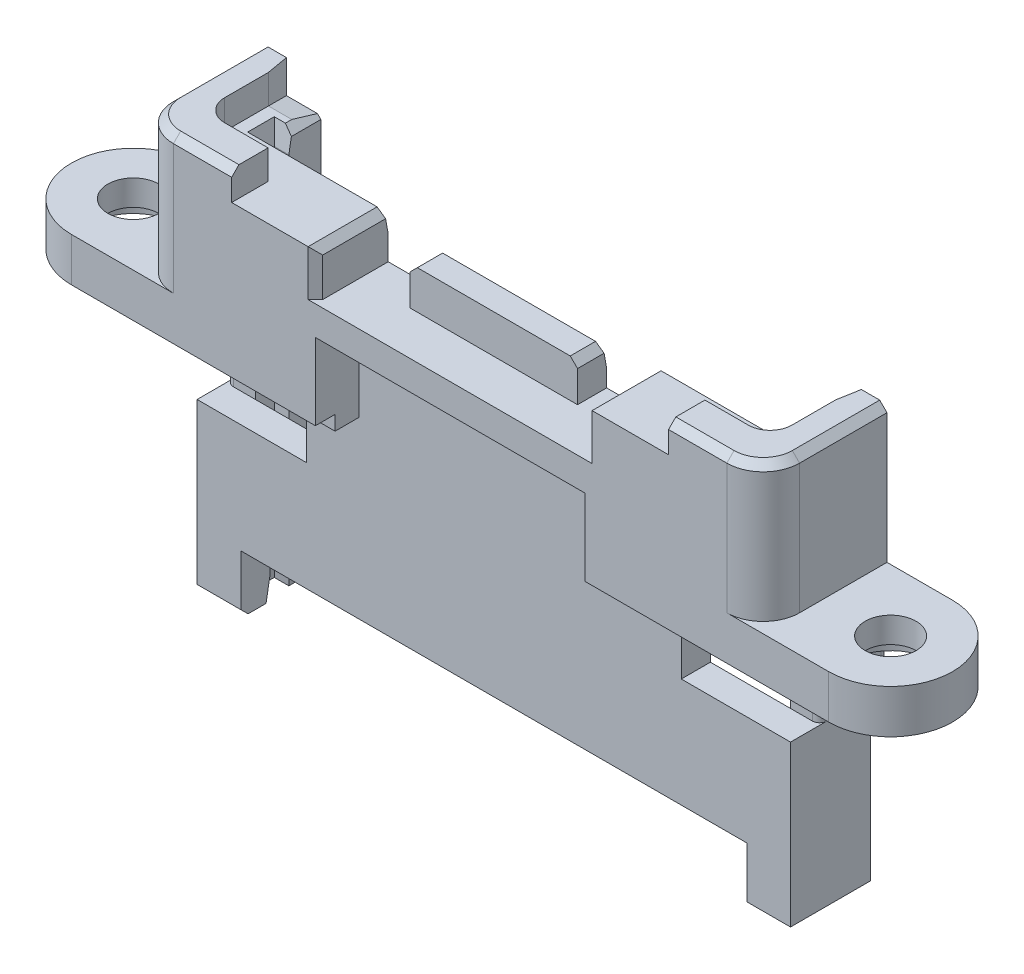
from build123d import *
from OCP.BRepFilletAPI import BRepFilletAPI_MakeChamfer

# Parameters (mm, degrees)
BOSS_EXTRUDE1_DEPTH             = 7.4
BOSS_EXTRUDE1_DEPTH_BACK        = 20
SKETCH2_R                       = 1.75
BOSS_EXTRUDE2_DEPTH             = 3
BOSS_EXTRUDE7_DEPTH             = 2
BOSS_EXTRUDE7_DIRECTION_2_REACH = 43.12
SKETCH21_R                      = 3
CUT_EXTRUDE11_DEPTH             = 1.25
CUT_EXTRUDE10_START             = -7.4
CUT_EXTRUDE10_DEPTH             = 7.4
CUT_EXTRUDE3_DEPTH              = 37.60686411
CUT_EXTRUDE3_DEPTH_BACK         = 37.60686411
SKETCH12_W                      = 3
SKETCH12_H                      = 17
CUT_EXTRUDE6_DEPTH              = 37.60686411
SKETCH19_W                      = 18.5
SKETCH19_H                      = 3.15
SKETCH19_H_2                    = 5.25
CUT_EXTRUDE9_DEPTH              = 37.678501878
SHELL1_OUTLINE_W                = 7.15
SHELL1_OUTLINE_H                = 6.4
SHELL1_DEPTH                    = 3
SKETCH13_W                      = 34.75
SKETCH13_H                      = 4
CUT_EXTRUDE4_DEPTH              = 37.60686411
SKETCH22_W                      = 7.5
SKETCH22_H                      = 2
CUT_EXTRUDE12_DEPTH             = 5.5
SKETCH23_W                      = 3
SKETCH23_H                      = 8.5
BOSS_EXTRUDE8_DEPTH             = 1.2
FILLET2_R                       = 0.5
CHAMFER3_SIZE                   = 0.5
CHAMFER4_SIZE                   = 0.5
BOSS_EXTRUDE9_DEPTH             = 1
CHAMFER5_SIZE                   = 1.5
CHAMFER5_SIZE2                  = 0.264490471


# Read off the part's stored shape, not the designer's step: Shell1
with BuildPart() as part:
    # Sketch1 → Boss-Extrude1 (new, two sides: drawn at the far end of the back side and taken through both)
    with BuildSketch(Plane(origin=(0, 0, 0), x_dir=(1, 0, 0), z_dir=(0, 1, 0)).offset(-BOSS_EXTRUDE1_DEPTH_BACK)):
        Polygon((17.375, 3.5), (20.375, 3.5), (20.375, -5), (-20.375, -5), (-20.375, 3.5), (-17.375, 3.5), (-17.375, 1.3), (-18.375, 1.3), (-18.375, 0), (18.375, 0), (18.375, 1.3), (17.375, 1.3), align=None)
    extrude(amount=BOSS_EXTRUDE1_DEPTH + BOSS_EXTRUDE1_DEPTH_BACK)

    # Sketch2 → Boss-Extrude2 (add)
    with BuildSketch(Plane(origin=(0, 0, 0), x_dir=(1, 0, 0), z_dir=(0, 1, 0))):
        with BuildLine():
            Line((20.375, -5), (26, -5))
            ThreePointArc((26, -5), (30.25, -0.75), (26, 3.5))
            Line((26, 3.5), (20.375, 3.5))
            Line((20.375, 3.5), (20.375, -5))
        make_face()
        with Locations(Location((26, -0.75, 0), (0, 0, 270))):
            Circle(SKETCH2_R, mode=Mode.SUBTRACT)
    boss_extrude2 = extrude(amount=-BOSS_EXTRUDE2_DEPTH)

    # Sketch8 → Boss-Extrude7 (add)
    with BuildSketch(Plane(origin=(0, 7.4, 0), x_dir=(1, 0, 0), z_dir=(0, 1, 0))):
        with BuildLine():
            Line((15, -5), (19, -5))
            ThreePointArc((19, -5), (20.767766953, -4.267766953), (21.5, -2.5))
            Line((21.5, -2.5), (21.5, 3.5))
            Line((21.5, 3.5), (19.475, 3.5))
            Line((19.475, 3.5), (19.475, -1))
            ThreePointArc((19.475, -1), (19.035660172, -2.060660172), (17.975, -2.5))
            Line((17.975, -2.5), (15, -2.5))
            Line((15, -2.5), (15, -5))
        make_face()
    boss_extrude7 = extrude(amount=BOSS_EXTRUDE7_DEPTH)

    # Sketch8 → Boss-Extrude7 direction 2 (add, up to next)
    with BuildSketch(Plane(origin=(0, 7.4, 0), x_dir=(1, 0, 0), z_dir=(0, 1, 0)), mode=Mode.PRIVATE) as boss_extrude7_direction_2_sk1:
        with BuildLine():
            Line((15, -5), (19, -5))
            ThreePointArc((19, -5), (20.767766953, -4.267766953), (21.5, -2.5))
            Line((21.5, -2.5), (21.5, 3.5))
            Line((21.5, 3.5), (19.475, 3.5))
            Line((19.475, 3.5), (19.475, -1))
            ThreePointArc((19.475, -1), (19.035660172, -2.060660172), (17.975, -2.5))
            Line((17.975, -2.5), (15, -2.5))
            Line((15, -2.5), (15, -5))
        make_face()
    boss_extrude7_direction_2_tool1 = extrude(boss_extrude7_direction_2_sk1.sketch, amount=-BOSS_EXTRUDE7_DIRECTION_2_REACH, mode=Mode.PRIVATE) - part.part
    boss_extrude7_direction_2 = boss_extrude7_direction_2_tool1.solids().sort_by_distance((16.4875, 7.4, 2.607005))[0]
    add(boss_extrude7_direction_2)

    # Sketch21 → Cut-Extrude11 (cut)
    with BuildSketch(Plane.XZ.offset(3)):
        with Locations(Location((26, 0.75, 0), (0, 0, 270))):
            Circle(SKETCH21_R)
    cut_extrude11 = extrude(amount=-CUT_EXTRUDE11_DEPTH, mode=Mode.SUBTRACT)

    # Sketch20 → Cut-Extrude10 (cut)
    with BuildSketch(Plane(origin=(0, 7.4, 0), x_dir=(1, 0, 0), z_dir=(0, 1, 0)).offset(CUT_EXTRUDE10_START)):
        with BuildLine():
            Line((20.375, -5), (20.375, -4.587911636))
            ThreePointArc((20.375, -4.587911636), (19.717711958, -4.894762941), (19, -5))
            Line((19, -5), (20.375, -5))
        make_face()
    cut_extrude10 = extrude(amount=CUT_EXTRUDE10_DEPTH, mode=Mode.SUBTRACT)

    # Mirror1: Boss-Extrude2, Boss-Extrude7, Boss-Extrude7 direction 2, Cut-Extrude11, Cut-Extrude10 across plane
    add(boss_extrude2.mirror(Plane(origin=(0, 0, 0), x_dir=(0, 0, 1), z_dir=(1, 0, 0))))
    add(boss_extrude7.mirror(Plane(origin=(0, 0, 0), x_dir=(0, 0, 1), z_dir=(1, 0, 0))))
    add(boss_extrude7_direction_2.mirror(Plane(origin=(0, 0, 0), x_dir=(0, 0, 1), z_dir=(1, 0, 0))))
    add(cut_extrude11.mirror(Plane(origin=(0, 0, 0), x_dir=(0, 0, 1), z_dir=(1, 0, 0))), mode=Mode.SUBTRACT)
    add(cut_extrude10.mirror(Plane(origin=(0, 0, 0), x_dir=(0, 0, 1), z_dir=(1, 0, 0))), mode=Mode.SUBTRACT)

    # Sketch12 → Cut-Extrude3 (cut, two sides: drawn at the far end of the back side and taken through both)
    with BuildSketch(Plane(origin=(0, 0, 0), x_dir=(0, 0, -1), z_dir=(1, 0, 0)).offset(-CUT_EXTRUDE3_DEPTH_BACK)):
        with Locations((-3.5, -11.5)):
            Rectangle(SKETCH12_W, SKETCH12_H)
    extrude(amount=CUT_EXTRUDE3_DEPTH + CUT_EXTRUDE3_DEPTH_BACK, mode=Mode.SUBTRACT)

    # Sketch15 → Cut-Extrude6 (cut, through all)
    with BuildSketch(Plane(origin=(0, 0, 0), x_dir=(-1, 0, 0), z_dir=(0, 0, -1))):
        Polygon((-9.25, 7.4), (-9.25, 4.25), (-5.75, 4.25), (-5.75, 6.9), (5.75, 6.9), (5.75, 4.25), (9.25, 4.25), (9.25, 7.4), align=None)
    extrude(amount=-CUT_EXTRUDE6_DEPTH, mode=Mode.SUBTRACT)

    # Sketch19 → Cut-Extrude9 (cut, through all)
    with BuildSketch(Plane.XY.offset(2)):
        with Locations((0, 5.825)):
            Rectangle(SKETCH19_W, SKETCH19_H)
        with Locations((0, -0.375)):
            Rectangle(SKETCH19_W, SKETCH19_H_2)
    extrude(amount=CUT_EXTRUDE9_DEPTH, mode=Mode.SUBTRACT)

    # Shell1 outline → Shell1 (cut)
    with BuildSketch(Plane.XY):
        with Locations((14.825, 2.2)):
            Rectangle(SHELL1_OUTLINE_W, SHELL1_OUTLINE_H)
        with Locations((-14.825, 2.2)):
            Rectangle(SHELL1_OUTLINE_W, SHELL1_OUTLINE_H)
    extrude(amount=SHELL1_DEPTH, mode=Mode.SUBTRACT)

    # Sketch13 → Cut-Extrude4 (cut, through all)
    with BuildSketch(Plane.XY):
        with Locations((0, -18)):
            Rectangle(SKETCH13_W, SKETCH13_H)
    extrude(amount=CUT_EXTRUDE4_DEPTH, mode=Mode.SUBTRACT)

    # Sketch22 → Cut-Extrude12 (cut)
    with BuildSketch(Plane.XZ.offset(3)):
        with Locations((16.625, 1)):
            Rectangle(SKETCH22_W, SKETCH22_H)
        with Locations((-16.625, 1)):
            Rectangle(SKETCH22_W, SKETCH22_H)
    extrude(amount=CUT_EXTRUDE12_DEPTH, mode=Mode.SUBTRACT)

    # Sketch23 → Boss-Extrude8 (add)
    with BuildSketch(Plane(origin=(0, 0, -3.5), x_dir=(-1, 0, 0), z_dir=(0, 0, -1))):
        with Locations((-18.875, -4.25)):
            Rectangle(SKETCH23_W, SKETCH23_H)
        with Locations((18.875, -4.25)):
            Rectangle(SKETCH23_W, SKETCH23_H)
    extrude(amount=BOSS_EXTRUDE8_DEPTH)

    # Fillet2
    fillet2_edges = [part.edges().sort_by_distance(p)[0] for p in [
        (20.375, -5.75, 0),
        (-20.375, -5.75, 0),
        (20.375, -4.25, -4.7),
        (-20.375, -4.25, -4.7),
    ]]
    fillet(fillet2_edges, radius=FILLET2_R)

    # Chamfer3
    chamfer3_edges = [part.edges().sort_by_distance(p)[0] for p in [
        (-20.767766953, 9.4, 4.267766953),
        (-21.5, 9.4, -0.5),
        (-17, 9.4, 5),
        (9.25, 7.4, 2.5),
        (-9.25, 5.825, 5),
        (-9.25, 7.4, 2.5),
        (9.25, 5.825, 5),
        (5.75, 6.9, 1),
        (-5.75, 6.9, 1),
        (17.375, 7.4, -2.4),
        (-17.375, 7.4, -2.4),
        (17, 9.4, 5),
        (20.767766953, 9.4, 4.267766953),
        (21.5, 9.4, -0.5),
    ]]
    chamfer(chamfer3_edges, length=CHAMFER3_SIZE)

    # Chamfer4
    chamfer4_edges = [part.edges().sort_by_distance(p)[0] for p in [
        (18.875, -20, -3.5),
        (20.375, -20, -0.75),
        (-18.875, -20, 2),
        (18.875, -20, 2),
        (-18.875, -20, -3.5),
        (-20.375, -20, -0.75),
    ]]
    chamfer(chamfer4_edges, length=CHAMFER4_SIZE)

    # Sketch25 → Boss-Extrude9 (add)
    with BuildSketch(Plane.XZ.offset(3)):
        with BuildLine():
            Line((-22.5, 2.65), (-12.875, 2.65))
            Line((-12.875, 2.65), (-12.875, 2))
            Line((-12.875, 2), (-9.25, 2))
            Line((-9.25, 2), (-9.25, 3.65))
            Line((-9.25, 3.65), (-22.5, 3.65))
            ThreePointArc((-22.5, 3.65), (-23, 3.15), (-22.5, 2.65))
        make_face()
        with BuildLine():
            Line((9.25, 2), (9.25, 3.65))
            Line((9.25, 3.65), (22.5, 3.65))
            ThreePointArc((22.5, 3.65), (23, 3.15), (22.5, 2.65))
            Line((22.5, 2.65), (12.875, 2.65))
            Line((12.875, 2.65), (12.875, 2))
            Line((12.875, 2), (9.25, 2))
        make_face()
    extrude(amount=BOSS_EXTRUDE9_DEPTH)

    # Chamfer5: one chamfer whose edges measure the first distance from different faces: ONE call of the kernel's chamfer builder (chamfer() names one face for all edges)
    chamfer5_edges_1 = [part.edges().sort_by_distance(p)[0] for p in [
        (-19.475, 8.4, -3.5),
    ]]
    chamfer5_side_1 = [part.faces().sort_by_distance(p)[0] for p in [
        (-19.475, 8.4, -1.25),
    ]]
    chamfer5_edges_2 = [part.edges().sort_by_distance(p)[0] for p in [
        (17.875, -20, -1.3),
        (18.125, 7.4, -1.3),
    ]]
    chamfer5_side_2 = [part.faces().sort_by_distance(p)[0] for p in [
        (17.87652765, -6.362022609, -1.3),
    ]]
    chamfer5_edges_3 = [part.edges().sort_by_distance(p)[0] for p in [
        (18.375, -20, -0.65),
        (18.375, 7.4, -0.65),
    ]]
    chamfer5_side_3 = [part.faces().sort_by_distance(p)[0] for p in [
        (18.375, -6.3, -0.65),
    ]]
    chamfer5_edges_4 = [part.edges().sort_by_distance(p)[0] for p in [
        (17.875, -20, 0),
        (-17.875, -20, 0),
        (0, -16, 0),
        (14.0625, 7.4, 0),
        (-14.0625, 7.4, 0),
        (0, 6.9, 0),
    ]]
    chamfer5_side_4 = [part.faces().sort_by_distance(p)[0] for p in [
        (0, -5.621913535, 0),
    ]]
    chamfer5_edges_5 = [part.edges().sort_by_distance(p)[0] for p in [
        (-18.375, -20, -0.65),
        (-18.375, 7.4, -0.65),
    ]]
    chamfer5_side_5 = [part.faces().sort_by_distance(p)[0] for p in [
        (-18.375, -6.3, -0.65),
    ]]
    chamfer5_edges_6 = [part.edges().sort_by_distance(p)[0] for p in [
        (-17.875, -20, -1.3),
        (-18.125, 7.4, -1.3),
    ]]
    chamfer5_side_6 = [part.faces().sort_by_distance(p)[0] for p in [
        (-17.87652765, -6.362022609, -1.3),
    ]]
    chamfer5_edges_7 = [part.edges().sort_by_distance(p)[0] for p in [
        (-17.375, -20, -2.15),
    ]]
    chamfer5_side_7 = [part.faces().sort_by_distance(p)[0] for p in [
        (-17.375, -6.18727649, -2.648694438),
    ]]
    chamfer5_edges_8 = [part.edges().sort_by_distance(p)[0] for p in [
        (-18.675, 7.4, -3.5),
    ]]
    chamfer5_side_8 = [part.faces().sort_by_distance(p)[0] for p in [
        (-14.347937222, 7.4, 1.651046547),
    ]]
    chamfer5_edges_9 = [part.edges().sort_by_distance(p)[0] for p in [
        (17.375, -20, -2.15),
    ]]
    chamfer5_side_9 = [part.faces().sort_by_distance(p)[0] for p in [
        (17.375, -6.18727649, -2.648694438),
    ]]
    chamfer5_edges_10 = [part.edges().sort_by_distance(p)[0] for p in [
        (18.675, 7.4, -3.5),
    ]]
    chamfer5_side_10 = [part.faces().sort_by_distance(p)[0] for p in [
        (14.347937222, 7.4, 1.651046547),
    ]]
    chamfer5_edges_11 = [part.edges().sort_by_distance(p)[0] for p in [
        (19.475, 8.4, -3.5),
    ]]
    chamfer5_side_11 = [part.faces().sort_by_distance(p)[0] for p in [
        (19.475, 8.4, -1.25),
    ]]
    chamfer5 = BRepFilletAPI_MakeChamfer(part.part.solid().wrapped)
    for e in chamfer5_edges_1:
        chamfer5.Add(CHAMFER5_SIZE, CHAMFER5_SIZE2, e.wrapped, chamfer5_side_1[0].wrapped)  # the first distance lies on this face
    for e in chamfer5_edges_2:
        chamfer5.Add(CHAMFER5_SIZE, CHAMFER5_SIZE2, e.wrapped, chamfer5_side_2[0].wrapped)  # the first distance lies on this face
    for e in chamfer5_edges_3:
        chamfer5.Add(CHAMFER5_SIZE, CHAMFER5_SIZE2, e.wrapped, chamfer5_side_3[0].wrapped)  # the first distance lies on this face
    for e in chamfer5_edges_4:
        chamfer5.Add(CHAMFER5_SIZE, CHAMFER5_SIZE2, e.wrapped, chamfer5_side_4[0].wrapped)  # the first distance lies on this face
    for e in chamfer5_edges_5:
        chamfer5.Add(CHAMFER5_SIZE, CHAMFER5_SIZE2, e.wrapped, chamfer5_side_5[0].wrapped)  # the first distance lies on this face
    for e in chamfer5_edges_6:
        chamfer5.Add(CHAMFER5_SIZE, CHAMFER5_SIZE2, e.wrapped, chamfer5_side_6[0].wrapped)  # the first distance lies on this face
    for e in chamfer5_edges_7:
        chamfer5.Add(CHAMFER5_SIZE, CHAMFER5_SIZE2, e.wrapped, chamfer5_side_7[0].wrapped)  # the first distance lies on this face
    for e in chamfer5_edges_8:
        chamfer5.Add(CHAMFER5_SIZE, CHAMFER5_SIZE2, e.wrapped, chamfer5_side_8[0].wrapped)  # the first distance lies on this face
    for e in chamfer5_edges_9:
        chamfer5.Add(CHAMFER5_SIZE, CHAMFER5_SIZE2, e.wrapped, chamfer5_side_9[0].wrapped)  # the first distance lies on this face
    for e in chamfer5_edges_10:
        chamfer5.Add(CHAMFER5_SIZE, CHAMFER5_SIZE2, e.wrapped, chamfer5_side_10[0].wrapped)  # the first distance lies on this face
    for e in chamfer5_edges_11:
        chamfer5.Add(CHAMFER5_SIZE, CHAMFER5_SIZE2, e.wrapped, chamfer5_side_11[0].wrapped)  # the first distance lies on this face
    add(Compound.cast(chamfer5.Shape()), mode=Mode.REPLACE)


solid = part.part
